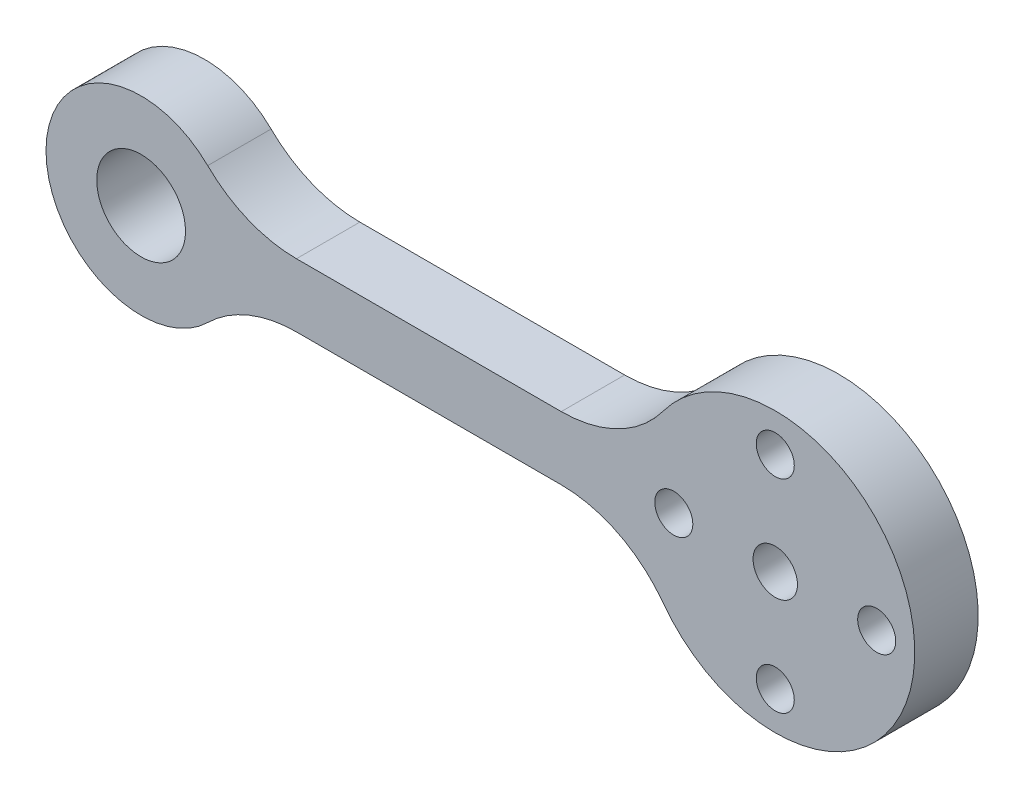
from build123d import *

# Parameters (mm, degrees)
SKETCH1_R          = 3.5
SKETCH1_R_2        = 1.5
SKETCH1_R_3        = 1.75
BASE_FLANGE1_DEPTH = 5
FILLET1_R          = 10


# Sheet-metal steps are written as plain solids
with BuildPart() as part:
    # Sketch1 → Base-Flange1 (new body)
    with BuildSketch(Plane.XY):
        with BuildLine():
            Line((7.071067812, 2.5), (39.287857357, 2.5))
            ThreePointArc((39.287857357, 2.5), (61, 0), (39.287857357, -2.5))
            Line((39.287857357, -2.5), (7.071067812, -2.5))
            ThreePointArc((7.071067812, -2.5), (-7.5, 0), (7.071067812, 2.5))
        make_face()
        Circle(SKETCH1_R, mode=Mode.SUBTRACT)
        with Locations((50, 8)):
            Circle(SKETCH1_R_2, mode=Mode.SUBTRACT)
        with Locations((58, 0)):
            Circle(SKETCH1_R_2, mode=Mode.SUBTRACT)
        with Locations((50, -8)):
            Circle(SKETCH1_R_2, mode=Mode.SUBTRACT)
        with Locations((42, 0)):
            Circle(SKETCH1_R_2, mode=Mode.SUBTRACT)
        with Locations((50, 0)):
            Circle(SKETCH1_R_3, mode=Mode.SUBTRACT)
    extrude(amount=-BASE_FLANGE1_DEPTH)

    # Fillet1
    fillet1_edges = [part.edges().sort_by_distance(p)[0] for p in [
        (7.071067812, 2.5, -2.5),
        (39.287857357, 2.5, -2.5),
        (39.287857357, -2.5, -2.5),
        (7.071067812, -2.5, -2.5),
    ]]
    fillet(fillet1_edges, radius=FILLET1_R)


solid = part.part
